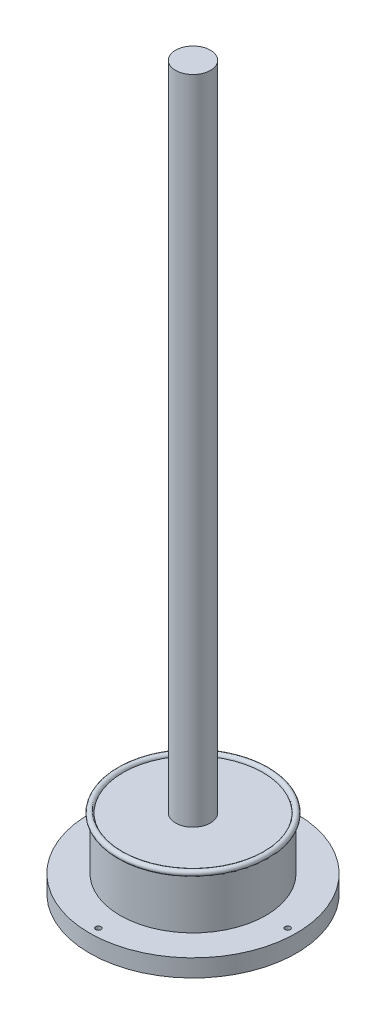
from build123d import *

# Parameters (mm, degrees)
SKETCH1_R                 = 39.749984
BOSS_EXTRUDE1_DEPTH       = 28.575
SKETCH2_R                 = 9.525
BOSS_EXTRUDE2_DEPTH       = 355.6
SKETCH3_R                 = 56.388
BOSS_EXTRUDE3_DEPTH       = 9.525
CHAMFER1_SIZE             = 1.27
SKETCH5_R                 = 1.5875
TAP_DRILL_FOR_4_40_TAP1_D = 2.8702


with BuildPart() as part:
    # Sketch1 → Boss-Extrude1 (new body)
    with BuildSketch(Plane(origin=(0, 0, 0), x_dir=(1, 0, 0), z_dir=(0, 1, 0))):
        Circle(SKETCH1_R)
    extrude(amount=BOSS_EXTRUDE1_DEPTH)

    # Sketch2 → Boss-Extrude2 (add)
    with BuildSketch(Plane(origin=(0, 28.575, 0), x_dir=(1, 0, 0), z_dir=(0, 1, 0))):
        Circle(SKETCH2_R)
    extrude(amount=BOSS_EXTRUDE2_DEPTH)

    # Sketch3 → Boss-Extrude3 (add)
    with BuildSketch(Plane.XZ):
        Circle(SKETCH3_R)
    extrude(amount=BOSS_EXTRUDE3_DEPTH)

    # Chamfer1
    chamfer1_edges = [part.edges().sort_by_distance(p)[0] for p in [
        (-39.749984, 28.575, 0),
    ]]
    chamfer(chamfer1_edges, length=CHAMFER1_SIZE)

    # Sketch5 → Revolve1 (revolve)
    with BuildSketch(Plane.XY):
        with Locations((-39.749984, 28.575)):
            Circle(SKETCH5_R)
    revolve(axis=Axis((0, 384.175, 0), (0, -1, 0)))

    # Tap Drill for #4-40 Tap1 (through all)
    with Locations(Plane(origin=(0, 0, 0), x_dir=(1, 0, 0), z_dir=(0, 1, 0))):
        with Locations((0, 51.6255), (51.6255, 0), (0, -51.6255), (-51.6255, 0)):
            Hole(TAP_DRILL_FOR_4_40_TAP1_D / 2)


solid = part.part
